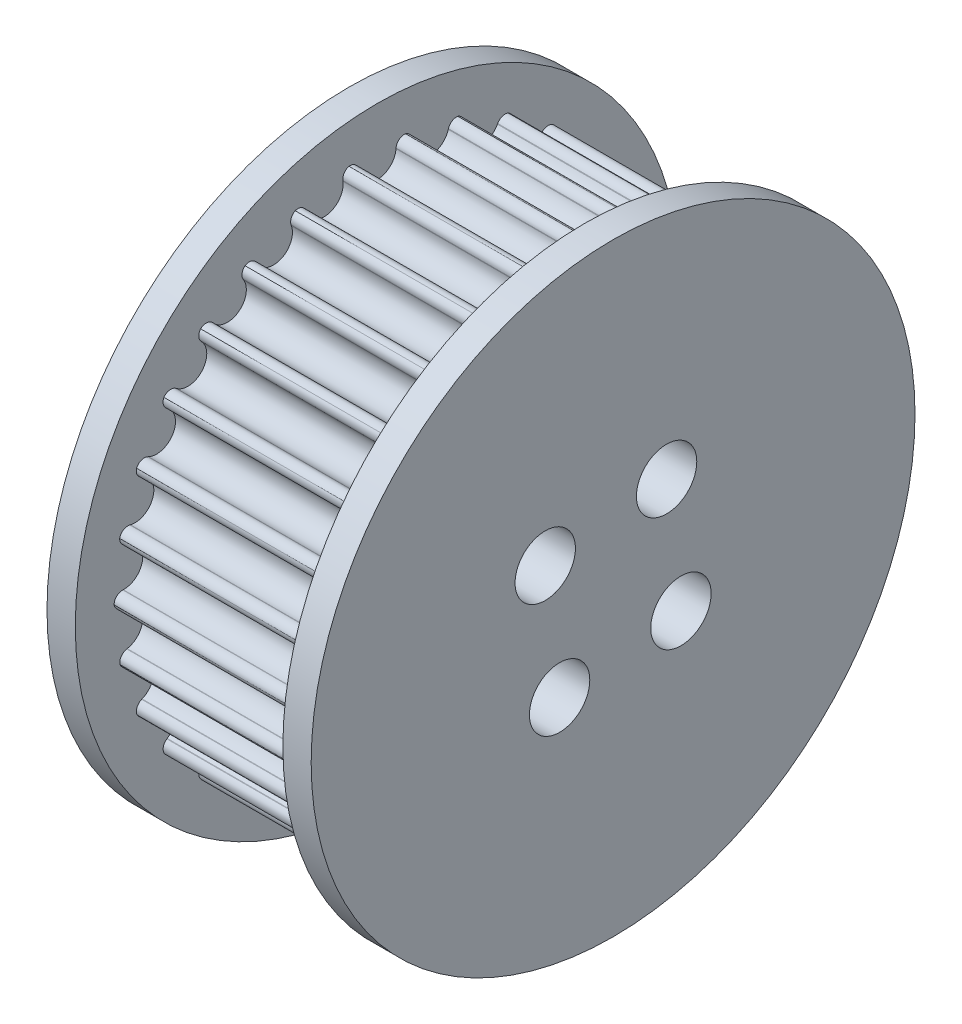
from build123d import *

# Parameters (mm, degrees)
SKETCH_1_R               = 16
EXTRUDE_1_DEPTH          = 1.5
SKETCH_2_R               = 13.945
EXTRUDE_2_DEPTH          = 11
CUT_EXTRUDE_START        = -11
CUT_EXTRUDE_1_DEPTH      = 11
FILLET_1_R               = 0.45
PATTERN_START            = 1.5
PATTERN_CIRCULAR_1_DEPTH = 11
SKETCH_4_R               = 16
EXTRUDE_3_DEPTH          = 1.5
HOLE_WIZARD_M3_1_D       = 3.2


# Read off the part's stored shape, not the designer's step: 阵列(圆周)1
with BuildPart() as part:
    # 草图1 → 凸台-拉伸1 (new body)
    with BuildSketch(Plane(origin=(0, 0, 0), x_dir=(0, 0, -1), z_dir=(1, 0, 0))):
        Circle(SKETCH_1_R)
    extrude(amount=EXTRUDE_1_DEPTH)

    # 草图2 → 凸台-拉伸2 (add)
    with BuildSketch(Plane(origin=(1.5, 0, 0), x_dir=(0, 0, -1), z_dir=(1, 0, 0))):
        Circle(SKETCH_2_R)
    extrude(amount=EXTRUDE_2_DEPTH)

    # 草图3 → 切除-拉伸1 (cut)
    with BuildSketch(Plane(origin=(12.5, 0, 0), x_dir=(0, 0, -1), z_dir=(1, 0, 0)).offset(CUT_EXTRUDE_START)):
        with BuildLine():
            Line((-0.997252742, 13.425925926), (-1.032962963, 13.906689488))
            ThreePointArc((-1.032962963, 13.906689488), (0, 13.945), (1.032962963, 13.906689488))
            Line((1.032962963, 13.906689488), (0.997252742, 13.425925926))
            ThreePointArc((0.997252742, 13.425925926), (0, 12.5), (-0.997252742, 13.425925926))
        make_face()
    extrude(amount=CUT_EXTRUDE_1_DEPTH, mode=Mode.SUBTRACT)

    # 圆角1
    fillet_1_edges = [part.edges().sort_by_distance(p)[0] for p in [
        (7, 13.906689488, 1.032962963),
        (7, 13.906689488, -1.032962963),
    ]]
    fillet(fillet_1_edges, radius=FILLET_1_R)

    # 阵列(圆周)1 outline → 阵列(圆周)1 (cut)
    with BuildSketch(Plane.YZ.offset(PATTERN_START)):
        with BuildLine():
            Line((12.948797983, 3.773745592), (12.925196728, 3.766867337))
            ThreePointArc((12.925196728, 3.766867337), (12.226845009, 2.598896135), (13.339877736, 1.815946583))
            Line((13.339877736, 1.815946583), (13.37062966, 1.820132817))
            ThreePointArc((13.37062966, 1.820132817), (13.678173697, 1.750499408), (13.864510817, 1.496116577))
            ThreePointArc((13.864510817, 1.496116577), (13.632172809, 2.937156703), (13.250477864, 4.346016726))
            ThreePointArc((13.250477864, 4.346016726), (13.220964034, 3.995922584), (12.948797983, 3.773745592))
        make_face()
        with BuildLine():
            ThreePointArc((12.954992704, -3.775550956), (13.207625703, -3.96425367), (13.274386313, -4.272434084))
            ThreePointArc((13.274386313, -4.272434084), (13.640268293, -2.899328528), (13.864510817, -1.496116577))
            ThreePointArc((13.864510817, -1.496116577), (13.678173697, -1.750499408), (13.37062966, -1.820132817))
            Line((13.37062966, -1.820132817), (13.339877736, -1.815946583))
            ThreePointArc((13.339877736, -1.815946583), (12.226845009, -2.598896135), (12.925196728, -3.766867337))
            Line((12.925196728, -3.766867337), (12.954992704, -3.775550956))
        make_face()
        with BuildLine():
            ThreePointArc((11.886913848, -6.386540547), (12.094792709, -6.623645008), (12.096020129, -6.938971252))
            ThreePointArc((12.096020129, -6.938971252), (12.755076867, -5.636580446), (13.274386314, -4.272434084))
            ThreePointArc((13.274386314, -4.272434084), (13.04472895, -4.538318402), (12.69394963, -4.558088173))
            Line((12.69394963, -4.558088173), (12.670812877, -4.549780329))
            ThreePointArc((12.670812877, -4.549780329), (11.419318221, -5.084208039), (11.859574412, -6.371851754))
            Line((11.859574412, -6.371851754), (11.886913848, -6.386540547))
        make_face()
        with BuildLine():
            ThreePointArc((10.299319817, -8.71840767), (10.453359237, -8.993551275), (10.388999822, -9.302242079))
            ThreePointArc((10.388999822, -9.302242079), (11.304436864, -8.165337237), (12.096020129, -6.938971252))
            ThreePointArc((12.096020129, -6.938971252), (11.816100872, -7.151296908), (11.468876555, -7.097703541))
            Line((11.468876555, -7.097703541), (11.447972694, -7.084766842))
            ThreePointArc((11.447972694, -7.084766842), (10.11271243, -7.347315654), (10.275631785, -8.698355674))
            Line((10.275631785, -8.698355674), (10.299319817, -8.71840767))
        make_face()
        with BuildLine():
            ThreePointArc((8.261596088, -10.669238542), (8.355063805, -10.970396196), (8.227930371, -11.25896029))
            ThreePointArc((8.227930371, -11.25896029), (9.359738725, -10.33722961), (10.388999822, -9.302242079))
            ThreePointArc((10.388999822, -9.302242079), (10.071052486, -9.451729424), (9.742558541, -9.327115206))
            Line((9.742558541, -9.327115206), (9.724801171, -9.310115047))
            ThreePointArc((9.724801171, -9.310115047), (8.364132579, -9.289310318), (8.242594741, -10.644699711))
            Line((8.242594741, -10.644699711), (8.261596088, -10.669238542))
        make_face()
        with BuildLine():
            ThreePointArc((5.862800967, -12.153772493), (5.891611993, -12.467782161), (5.707260881, -12.72360791))
            ThreePointArc((5.707260881, -12.72360791), (7.005975091, -12.057335445), (8.227930371, -11.25896029))
            ThreePointArc((8.227930371, -11.25896029), (7.88585078, -11.339076009), (7.590443969, -11.14888718))
            Line((7.590443969, -11.14888718), (7.576609172, -11.12856655))
            ThreePointArc((7.576609172, -11.12856655), (6.25, -10.825317547), (5.849316754, -12.125819292))
            Line((5.849316754, -12.125819292), (5.862800967, -12.153772493))
        make_face()
        with BuildLine():
            ThreePointArc((3.20777331, -13.107128265), (3.170668466, -13.420266218), (2.937156703, -13.632172809))
            ThreePointArc((2.937156703, -13.632172809), (4.346016726, -13.250477864), (5.707260881, -12.72360791))
            ThreePointArc((5.707260881, -12.72360791), (5.355999555, -12.730850562), (5.106590573, -12.483399285))
            Line((5.106590573, -12.483399285), (5.097282995, -12.460646294))
            ThreePointArc((5.097282995, -12.460646294), (3.86271243, -11.888206454), (3.200395558, -13.076982384))
            Line((3.200395558, -13.076982384), (3.20777331, -13.107128265))
        make_face()
        with BuildLine():
            ThreePointArc((0.412550568, -13.487639638), (0.311151512, -13.786220244), (0.038684684, -13.944946343))
            ThreePointArc((0.038684684, -13.944946343), (1.496116577, -13.864510817), (2.937156703, -13.632172809))
            ThreePointArc((2.937156703, -13.632172809), (2.592065448, -13.566225856), (2.399554664, -13.27232694))
            Line((2.399554664, -13.27232694), (2.395181092, -13.248136002))
            ThreePointArc((2.395181092, -13.248136002), (1.30660579, -12.431523692), (0.411601718, -13.456618596))
            Line((0.411601718, -13.456618596), (0.412550568, -13.487639638))
        make_face()
        with BuildLine():
            ThreePointArc((-2.400702614, -13.278676438), (-2.561964256, -13.549650292), (-2.861478041, -13.648258805))
            ThreePointArc((-2.861478041, -13.648258805), (-1.419171046, -13.872598118), (0.038684684, -13.944946343))
            ThreePointArc((0.038684684, -13.944946343), (-0.285154357, -13.808691982), (-0.412353298, -13.48119022))
            Line((-0.412353298, -13.48119022), (-0.411601718, -13.456618596))
            ThreePointArc((-0.411601718, -13.456618596), (-1.30660579, -12.431523692), (-2.395181092, -13.248136002))
            Line((-2.395181092, -13.248136002), (-2.400702614, -13.278676438))
        make_face()
        with BuildLine():
            ThreePointArc((-5.109033572, -12.489371359), (-5.323109893, -12.720895603), (-5.636580446, -12.755076867))
            ThreePointArc((-5.636580446, -12.755076867), (-4.272434084, -13.274386313), (-2.861478041, -13.648258806))
            ThreePointArc((-2.861478041, -13.648258806), (-3.149911548, -13.447652008), (-3.206239442, -13.100860798))
            Line((-3.206239442, -13.100860798), (-3.200395558, -13.076982384))
            ThreePointArc((-3.200395558, -13.076982384), (-3.86271243, -11.888206454), (-5.097282995, -12.460646294))
            Line((-5.097282995, -12.460646294), (-5.109033572, -12.489371359))
        make_face()
        with BuildLine():
            ThreePointArc((-7.594075247, -11.154220821), (-7.851610083, -11.336176735), (-8.165337237, -11.304436864))
            ThreePointArc((-8.165337237, -11.304436864), (-6.938971252, -12.096020129), (-5.636580446, -12.755076867))
            ThreePointArc((-5.636580446, -12.755076867), (-5.877002489, -12.498885111), (-5.859997537, -12.147960893))
            Line((-5.859997537, -12.147960893), (-5.849316754, -12.125819292))
            ThreePointArc((-5.849316754, -12.125819292), (-6.25, -10.825317547), (-7.576609172, -11.12856655))
            Line((-7.576609172, -11.12856655), (-7.594075247, -11.154220821))
        make_face()
        with BuildLine():
            ThreePointArc((-9.747219393, -9.331577309), (-10.036957237, -9.456012547), (-10.33722961, -9.359738725))
            ThreePointArc((-10.33722961, -9.359738725), (-9.302242079, -10.388999822), (-8.165337237, -11.304436864))
            ThreePointArc((-8.165337237, -11.304436864), (-8.347240221, -11.003856959), (-8.25764562, -10.664136806))
            Line((-8.25764562, -10.664136806), (-8.242594741, -10.644699711))
            ThreePointArc((-8.242594741, -10.644699711), (-8.364132579, -9.289310318), (-9.724801171, -9.310115047))
            Line((-9.724801171, -9.310115047), (-9.747219393, -9.331577309))
        make_face()
        with BuildLine():
            ThreePointArc((-11.47436328, -7.101099091), (-11.783641197, -7.162575236), (-12.057335445, -7.005975091))
            ThreePointArc((-12.057335445, -7.005975091), (-11.25896029, -8.227930371), (-10.33722961, -9.359738725))
            ThreePointArc((-10.33722961, -9.359738725), (-10.452663501, -9.027907455), (-10.294394966, -8.714238767))
            Line((-10.294394966, -8.714238767), (-10.275631785, -8.698355674))
            ThreePointArc((-10.275631785, -8.698355674), (-10.11271243, -7.347315654), (-11.447972694, -7.084766842))
            Line((-11.447972694, -7.084766842), (-11.47436328, -7.101099091))
        make_face()
        with BuildLine():
            ThreePointArc((-12.700022431, -4.560268768), (-13.015323493, -4.556099016), (-13.250477864, -4.346016726))
            ThreePointArc((-13.250477864, -4.346016726), (-12.72360791, -5.707260881), (-12.057335445, -7.005975091))
            ThreePointArc((-12.057335445, -7.005975091), (-12.101255228, -6.657395075), (-11.881229853, -6.383486679))
            Line((-11.881229853, -6.383486679), (-11.859574412, -6.371851754))
            ThreePointArc((-11.859574412, -6.371851754), (-11.419318221, -5.084208039), (-12.670812877, -4.549780329))
            Line((-12.670812877, -4.549780329), (-12.700022431, -4.560268768))
        make_face()
        with BuildLine():
            ThreePointArc((-13.37062966, -1.820132817), (-13.678173697, -1.750499408), (-13.864510817, -1.496116577))
            ThreePointArc((-13.864510817, -1.496116577), (-13.632172809, -2.937156703), (-13.250477864, -4.346016726))
            ThreePointArc((-13.250477864, -4.346016726), (-13.220964034, -3.995922584), (-12.948797983, -3.773745592))
            Line((-12.948797983, -3.773745592), (-12.925196728, -3.766867337))
            ThreePointArc((-12.925196728, -3.766867337), (-12.226845009, -2.598896135), (-13.339877736, -1.815946583))
            Line((-13.339877736, -1.815946583), (-13.37062966, -1.820132817))
        make_face()
        with BuildLine():
            ThreePointArc((-13.456876214, 0.999551672), (-13.743222076, 1.131605425), (-13.872598118, 1.419171046))
            ThreePointArc((-13.872598118, 1.419171046), (-13.944946343, -0.038684684), (-13.864510817, -1.496116577))
            ThreePointArc((-13.864510817, -1.496116577), (-13.76285327, -1.159809102), (-13.450441506, -0.999073714))
            Line((-13.450441506, -0.999073714), (-13.425925926, -0.997252742))
            ThreePointArc((-13.425925926, -0.997252742), (-12.5, 0), (-13.425925926, 0.997252742))
            Line((-13.425925926, 0.997252742), (-13.456876214, 0.999551672))
        make_face()
        with BuildLine():
            ThreePointArc((-12.954992704, 3.775550956), (-13.207625703, 3.96425367), (-13.274386313, 4.272434084))
            ThreePointArc((-13.274386313, 4.272434084), (-13.648258805, 2.861478041), (-13.872598118, 1.419171046))
            ThreePointArc((-13.872598118, 1.419171046), (-13.703239776, 1.726993604), (-13.364236193, 1.81926248))
            Line((-13.364236193, 1.81926248), (-13.339877736, 1.815946583))
            ThreePointArc((-13.339877736, 1.815946583), (-12.226845009, 2.598896135), (-12.925196728, 3.766867337))
            Line((-12.925196728, 3.766867337), (-12.954992704, 3.775550956))
        make_face()
        with BuildLine():
            ThreePointArc((-11.886913848, 6.386540547), (-12.094792709, 6.623645008), (-12.096020129, 6.938971252))
            ThreePointArc((-12.096020129, 6.938971252), (-12.755076867, 5.636580446), (-13.274386313, 4.272434084))
            ThreePointArc((-13.274386313, 4.272434084), (-13.04472895, 4.538318402), (-12.69394963, 4.558088173))
            Line((-12.69394963, 4.558088173), (-12.670812877, 4.549780329))
            ThreePointArc((-12.670812877, 4.549780329), (-11.419318221, 5.084208039), (-11.859574412, 6.371851754))
            Line((-11.859574412, 6.371851754), (-11.886913848, 6.386540547))
        make_face()
        with BuildLine():
            ThreePointArc((-10.299319817, 8.71840767), (-10.453359237, 8.993551275), (-10.388999822, 9.302242079))
            ThreePointArc((-10.388999822, 9.302242079), (-11.304436864, 8.165337237), (-12.096020129, 6.938971252))
            ThreePointArc((-12.096020129, 6.938971252), (-11.816100872, 7.151296908), (-11.468876555, 7.097703541))
            Line((-11.468876555, 7.097703541), (-11.447972694, 7.084766842))
            ThreePointArc((-11.447972694, 7.084766842), (-10.11271243, 7.347315654), (-10.275631785, 8.698355674))
            Line((-10.275631785, 8.698355674), (-10.299319817, 8.71840767))
        make_face()
        with BuildLine():
            ThreePointArc((-8.261596088, 10.669238542), (-8.355063805, 10.970396196), (-8.227930371, 11.25896029))
            ThreePointArc((-8.227930371, 11.25896029), (-9.359738725, 10.33722961), (-10.388999822, 9.302242079))
            ThreePointArc((-10.388999822, 9.302242079), (-10.071052486, 9.451729424), (-9.742558541, 9.327115206))
            Line((-9.742558541, 9.327115206), (-9.724801171, 9.310115047))
            ThreePointArc((-9.724801171, 9.310115047), (-8.364132579, 9.289310318), (-8.242594741, 10.644699711))
            Line((-8.242594741, 10.644699711), (-8.261596088, 10.669238542))
        make_face()
        with BuildLine():
            ThreePointArc((-5.862800967, 12.153772493), (-5.891611993, 12.467782161), (-5.707260881, 12.72360791))
            ThreePointArc((-5.707260881, 12.72360791), (-7.005975091, 12.057335445), (-8.227930371, 11.25896029))
            ThreePointArc((-8.227930371, 11.25896029), (-7.88585078, 11.339076009), (-7.590443969, 11.14888718))
            Line((-7.590443969, 11.14888718), (-7.576609172, 11.12856655))
            ThreePointArc((-7.576609172, 11.12856655), (-6.25, 10.825317547), (-5.849316754, 12.125819292))
            Line((-5.849316754, 12.125819292), (-5.862800967, 12.153772493))
        make_face()
        with BuildLine():
            ThreePointArc((-3.20777331, 13.107128265), (-3.170668466, 13.420266218), (-2.937156703, 13.632172809))
            ThreePointArc((-2.937156703, 13.632172809), (-4.346016726, 13.250477864), (-5.707260881, 12.72360791))
            ThreePointArc((-5.707260881, 12.72360791), (-5.355999555, 12.730850562), (-5.106590573, 12.483399285))
            Line((-5.106590573, 12.483399285), (-5.097282995, 12.460646294))
            ThreePointArc((-5.097282995, 12.460646294), (-3.86271243, 11.888206454), (-3.200395558, 13.076982384))
            Line((-3.200395558, 13.076982384), (-3.20777331, 13.107128265))
        make_face()
        with BuildLine():
            ThreePointArc((-0.412550568, 13.487639638), (-0.311151512, 13.786220244), (-0.038684684, 13.944946343))
            ThreePointArc((-0.038684684, 13.944946343), (-1.496116577, 13.864510817), (-2.937156703, 13.632172809))
            ThreePointArc((-2.937156703, 13.632172809), (-2.592065448, 13.566225856), (-2.399554664, 13.27232694))
            Line((-2.399554664, 13.27232694), (-2.395181092, 13.248136002))
            ThreePointArc((-2.395181092, 13.248136002), (-1.30660579, 12.431523692), (-0.411601718, 13.456618596))
            Line((-0.411601718, 13.456618596), (-0.412550568, 13.487639638))
        make_face()
        with BuildLine():
            ThreePointArc((2.400702614, 13.278676438), (2.561964256, 13.549650292), (2.861478041, 13.648258805))
            ThreePointArc((2.861478041, 13.648258805), (1.419171046, 13.872598118), (-0.038684684, 13.944946343))
            ThreePointArc((-0.038684684, 13.944946343), (0.285154357, 13.808691982), (0.412353298, 13.48119022))
            Line((0.412353298, 13.48119022), (0.411601718, 13.456618596))
            ThreePointArc((0.411601718, 13.456618596), (1.30660579, 12.431523692), (2.395181092, 13.248136002))
            Line((2.395181092, 13.248136002), (2.400702614, 13.278676438))
        make_face()
        with BuildLine():
            ThreePointArc((5.109033572, 12.489371359), (5.323109893, 12.720895603), (5.636580446, 12.755076867))
            ThreePointArc((5.636580446, 12.755076867), (4.272434084, 13.274386313), (2.861478041, 13.648258806))
            ThreePointArc((2.861478041, 13.648258806), (3.149911548, 13.447652008), (3.206239442, 13.100860798))
            Line((3.206239442, 13.100860798), (3.200395558, 13.076982384))
            ThreePointArc((3.200395558, 13.076982384), (3.86271243, 11.888206454), (5.097282995, 12.460646294))
            Line((5.097282995, 12.460646294), (5.109033572, 12.489371359))
        make_face()
        with BuildLine():
            ThreePointArc((7.594075247, 11.154220821), (7.851610083, 11.336176735), (8.165337237, 11.304436864))
            ThreePointArc((8.165337237, 11.304436864), (6.938971252, 12.096020129), (5.636580446, 12.755076867))
            ThreePointArc((5.636580446, 12.755076867), (5.877002489, 12.498885111), (5.859997537, 12.147960893))
            Line((5.859997537, 12.147960893), (5.849316754, 12.125819292))
            ThreePointArc((5.849316754, 12.125819292), (6.25, 10.825317547), (7.576609172, 11.12856655))
            Line((7.576609172, 11.12856655), (7.594075247, 11.154220821))
        make_face()
        with BuildLine():
            ThreePointArc((9.747219393, 9.331577309), (10.036957237, 9.456012547), (10.33722961, 9.359738725))
            ThreePointArc((10.33722961, 9.359738725), (9.302242079, 10.388999822), (8.165337237, 11.304436864))
            ThreePointArc((8.165337237, 11.304436864), (8.347240221, 11.003856959), (8.25764562, 10.664136806))
            Line((8.25764562, 10.664136806), (8.242594741, 10.644699711))
            ThreePointArc((8.242594741, 10.644699711), (8.364132579, 9.289310318), (9.724801171, 9.310115047))
            Line((9.724801171, 9.310115047), (9.747219393, 9.331577309))
        make_face()
        with BuildLine():
            ThreePointArc((11.47436328, 7.101099091), (11.783641197, 7.162575236), (12.057335445, 7.005975091))
            ThreePointArc((12.057335445, 7.005975091), (11.25896029, 8.227930371), (10.33722961, 9.359738725))
            ThreePointArc((10.33722961, 9.359738725), (10.452663501, 9.027907455), (10.294394966, 8.714238767))
            Line((10.294394966, 8.714238767), (10.275631785, 8.698355674))
            ThreePointArc((10.275631785, 8.698355674), (10.11271243, 7.347315654), (11.447972694, 7.084766842))
            Line((11.447972694, 7.084766842), (11.47436328, 7.101099091))
        make_face()
        with BuildLine():
            ThreePointArc((12.700022431, 4.560268768), (13.015323493, 4.556099016), (13.250477864, 4.346016726))
            ThreePointArc((13.250477864, 4.346016726), (12.72360791, 5.707260881), (12.057335445, 7.005975091))
            ThreePointArc((12.057335445, 7.005975091), (12.101255228, 6.657395075), (11.881229853, 6.383486679))
            Line((11.881229853, 6.383486679), (11.859574412, 6.371851754))
            ThreePointArc((11.859574412, 6.371851754), (11.419318221, 5.084208039), (12.670812877, 4.549780329))
            Line((12.670812877, 4.549780329), (12.700022431, 4.560268768))
        make_face()
    extrude(amount=PATTERN_CIRCULAR_1_DEPTH, mode=Mode.SUBTRACT)

    # 草图4 → 凸台-拉伸3 (add)
    with BuildSketch(Plane(origin=(12.5, 0, 0), x_dir=(0, 0, -1), z_dir=(1, 0, 0))):
        Circle(SKETCH_4_R)
    extrude(amount=EXTRUDE_3_DEPTH)

    # M3 间隙孔1 (through all)
    with Locations(Plane(origin=(14, 0, 0), x_dir=(0, 0, -1), z_dir=(1, 0, 0))):
        with Locations((-3.595484396, 2.835164157), (-2.835164157, -3.595484396), (2.835164157, 3.595484396), (3.595484396, -2.835164157)):
            Hole(HOLE_WIZARD_M3_1_D / 2)


solid = part.part
